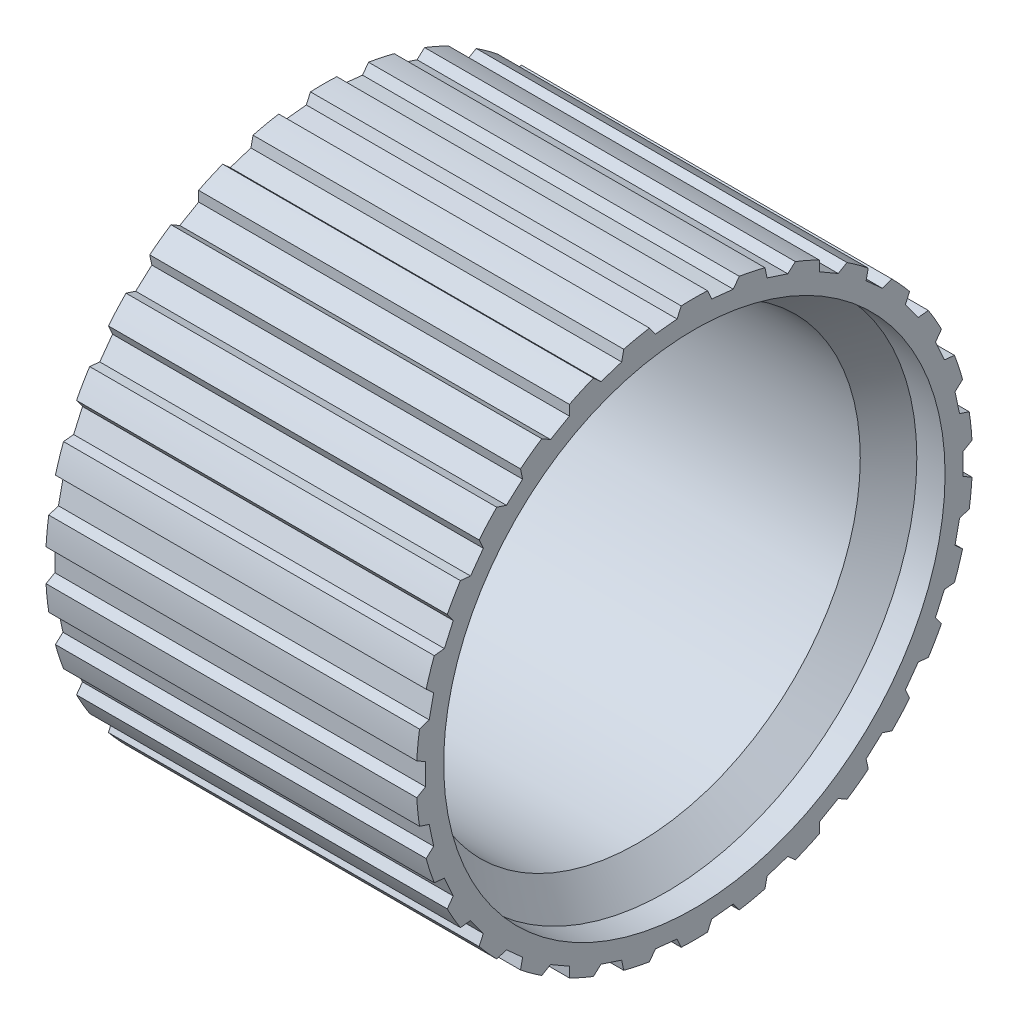
from build123d import *

# Parameters (mm, degrees)
CUT_EXTRUDE2_DEPTH = 47.904157598
CIRPATTERN4_COUNT  = 30


with BuildPart() as part:
    # Sketch1 → Revolve1 (revolve)
    with BuildSketch(Plane.XY, mode=Mode.PRIVATE) as revolve1_sk:
        Polygon((-20, 30), (20, 30), (20, 27.05), (16.95, 27.05), (13.9, 24), (-16.95, 24), (-16.95, 27.05), (-20, 27.05), align=None)
    revolve(revolve1_sk.sketch.rotate(Axis((22, 0, 0), (-1, 0, 0)), 90), axis=Axis((22, 0, 0), (-1, 0, 0)))

    # Sketch6 → Cut-Extrude2 (cut, symmetric)
    with BuildSketch(Plane(origin=(0, 0, 0), x_dir=(0, 0, -1), z_dir=(1, 0, 0))):
        Polygon((-30, 1.75), (-29, 1.172649731), (-29, -1.172649731), (-30, -1.75), align=None)
    cut_extrude2 = extrude(amount=CUT_EXTRUDE2_DEPTH, both=True, mode=Mode.SUBTRACT)

    # CirPattern4: Cut-Extrude2 ×30 about axis
    cirpattern4_axis = Axis((0, 0, 0), (1, 0, 0))
    for i in range(1, CIRPATTERN4_COUNT):
        add(cut_extrude2.rotate(cirpattern4_axis, i * 360 / CIRPATTERN4_COUNT), mode=Mode.SUBTRACT)


solid = part.part
